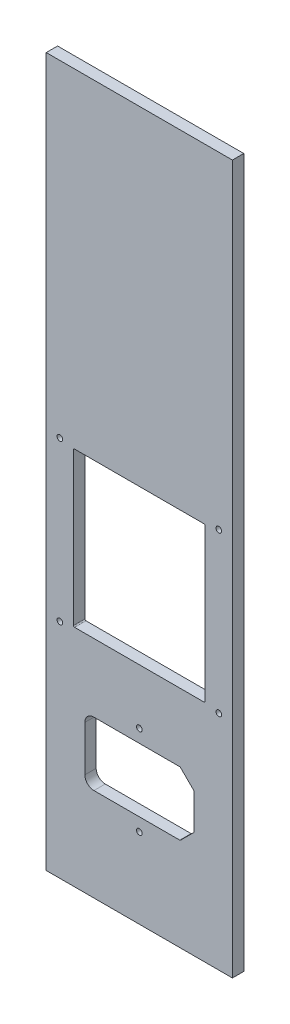
from build123d import *

# Parameters (mm, degrees)
SKETCH1_W             = 82
SKETCH1_H             = 312
BOSS_EXTRUDE1_DEPTH   = 5
SKETCH2_R             = 1.25
SKETCH2_W             = 48
SKETCH2_H             = 28
CUT_EXTRUDE1_DEPTH    = 10
CHAMFER1_SIZE         = 6
FILLET1_R             = 4
SKETCH3_W             = 58
SKETCH3_H             = 68
CUT_EXTRUDE2_DEPTH    = 162.375338884
M3X0_5_TAPPED_HOLE1_D = 2.5
FILLET2_R             = 0.5


with BuildPart() as part:
    # Sketch1 → Boss-Extrude1 (new body)
    with BuildSketch(Plane.XY):
        Rectangle(SKETCH1_W, SKETCH1_H)
    extrude(amount=BOSS_EXTRUDE1_DEPTH)

    # Sketch2 → Cut-Extrude1 (cut)
    with BuildSketch(Plane.XY.offset(5)):
        with Locations((0, -81.25)):
            Circle(SKETCH2_R)
        with Locations((0, -120.75)):
            Circle(SKETCH2_R)
        with Locations((0, -101)):
            Rectangle(SKETCH2_W, SKETCH2_H)
    extrude(amount=-CUT_EXTRUDE1_DEPTH, mode=Mode.SUBTRACT)

    # Chamfer1
    chamfer1_edges = [part.edges().sort_by_distance(p)[0] for p in [
        (24, -115, 2.5),
        (24, -87, 2.5),
    ]]
    chamfer(chamfer1_edges, length=CHAMFER1_SIZE)

    # Fillet1
    fillet1_edges = [part.edges().sort_by_distance(p)[0] for p in [
        (-24, -115, 2.5),
        (-24, -87, 2.5),
    ]]
    fillet(fillet1_edges, radius=FILLET1_R)

    # Sketch3 → Cut-Extrude2 (cut, through all)
    with BuildSketch(Plane.XY.offset(5)):
        with Locations((0, -23)):
            Rectangle(SKETCH3_W, SKETCH3_H)
    extrude(amount=-CUT_EXTRUDE2_DEPTH, mode=Mode.SUBTRACT)

    # M3x0.5 Tapped Hole1 (through all)
    with Locations(Plane.XY.offset(5)):
        with Locations((-35, 12), (35, 12), (35, -58), (-35, -58)):
            Hole(M3X0_5_TAPPED_HOLE1_D / 2)

    # Fillet2
    fillet2_edges = [part.edges().sort_by_distance(p)[0] for p in [
        (18, -115, 2.5),
        (24, -109, 2.5),
        (24, -93, 2.5),
        (18, -87, 2.5),
        (29, -57, 2.5),
        (-29, -57, 2.5),
        (-29, 11, 2.5),
        (29, 11, 2.5),
    ]]
    fillet(fillet2_edges, radius=FILLET2_R)


solid = part.part
